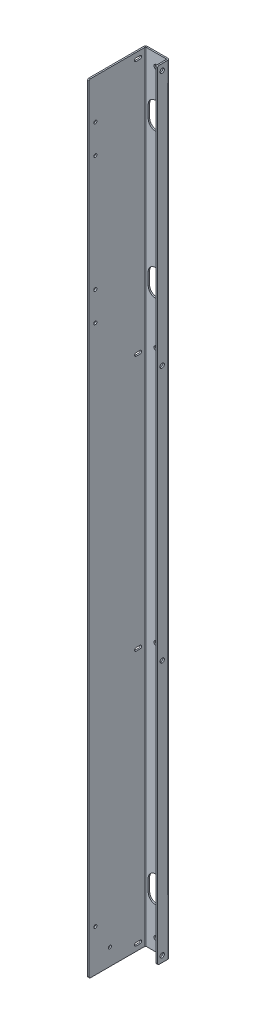
from build123d import *

# Parameters (mm, degrees)
BASE_FLANGE1_DEPTH = 1613
CUT_EXTRUDE1_REACH = 1620.23
FILLET1_R          = 3
CUT_EXTRUDE2_REACH = 1620.23
SKETCH7_R          = 4.5
LPATTERN1_COUNT    = 4
LPATTERN1_PITCH    = 529
CUT_EXTRUDE3_REACH = 1620.23
SKETCH8_R          = 3.25
CUT_EXTRUDE4_REACH = 1619.431
CUT_EXTRUDE5_REACH = 1619.431
SKETCH10_R         = 4.5
LPATTERN2_COUNT    = 3
LPATTERN2_PITCH    = 529
CUT_EXTRUDE6_REACH = 1619.431
SKETCH12_R         = 4.5


# Sheet-metal steps are written as plain solids
with BuildPart() as part:
    # Sketch1 → Base-Flange1 (new body)
    with BuildSketch(Plane(origin=(0, 0, 0), x_dir=(1, 0, 0), z_dir=(0, 1, 0))):
        with BuildLine():
            Line((-25, -120), (-25, -4.5))
            ThreePointArc((-25, -4.5), (-23.681980515, -1.318019485), (-20.5, 0))
            Line((-20.5, 0), (20.5, 0))
            ThreePointArc((20.5, 0), (23.681980515, -1.318019485), (25, -4.5))
            Line((25, -4.5), (25, -25))
            Line((25, -25), (22, -25))
            Line((22, -25), (22, -4.5))
            ThreePointArc((22, -4.5), (21.560660172, -3.439339828), (20.5, -3))
            Line((20.5, -3), (-20.5, -3))
            ThreePointArc((-20.5, -3), (-21.560660172, -3.439339828), (-22, -4.5))
            Line((-22, -4.5), (-22, -120))
            Line((-22, -120), (-25, -120))
        make_face()
    extrude(amount=BASE_FLANGE1_DEPTH)

    # Sketch6 → Cut-Extrude1 (cut, up to next)
    with BuildSketch(Plane.ZY.offset(25), mode=Mode.PRIVATE) as cut_extrude1_sk1:
        with BuildLine():
            Line((14.5, 16.25), (22.5, 16.25))
            ThreePointArc((22.5, 16.25), (25.75, 13), (22.5, 9.75))
            Line((22.5, 9.75), (14.5, 9.75))
            ThreePointArc((14.5, 9.75), (11.25, 13), (14.5, 16.25))
        make_face()
    cut_extrude1_tool1 = extrude(cut_extrude1_sk1.sketch, amount=-CUT_EXTRUDE1_REACH, mode=Mode.PRIVATE) & part.part
    cut_extrude1 = cut_extrude1_tool1.solids().sort_by_distance((-25, 13, 18.5))[0]
    add(cut_extrude1, mode=Mode.SUBTRACT)

    # Fillet1
    fillet1_edges = [part.edges().sort_by_distance(p)[0] for p in [
        (23.5, 0, 25),
        (-23.5, 0, 120),
        (23.5, 1613, 25),
        (-23.5, 1613, 120),
    ]]
    fillet(fillet1_edges, radius=FILLET1_R)

    # Sketch7 → Cut-Extrude2 (cut, up to next)
    with BuildSketch(Plane(origin=(25, 0, 0), x_dir=(0, 0, -1), z_dir=(1, 0, 0)), mode=Mode.PRIVATE) as cut_extrude2_sk1:
        with Locations((-15.5, 13)):
            Circle(SKETCH7_R)
    cut_extrude2_tool1 = extrude(cut_extrude2_sk1.sketch, amount=-CUT_EXTRUDE2_REACH, mode=Mode.PRIVATE) & part.part
    cut_extrude2 = cut_extrude2_tool1.solids().sort_by_distance((25, 13, 15.5))[0]
    add(cut_extrude2, mode=Mode.SUBTRACT)

    # LPattern1: Cut-Extrude1, Cut-Extrude2 ×4
    with Locations(*[(0, i * LPATTERN1_PITCH, 0) for i in range(1, LPATTERN1_COUNT)]):
        add(cut_extrude1, mode=Mode.SUBTRACT)
        add(cut_extrude2, mode=Mode.SUBTRACT)

    # Sketch8 → Cut-Extrude3 (cut, up to next)
    with BuildSketch(Plane.ZY.offset(25), mode=Mode.PRIVATE) as cut_extrude3_sk1:
        with Locations((107, 86.961524227)):
            Circle(SKETCH8_R)
    cut_extrude3_tool1 = extrude(cut_extrude3_sk1.sketch, amount=-CUT_EXTRUDE3_REACH, mode=Mode.PRIVATE) & part.part
    # Sketch8 → Cut-Extrude3 (cut, up to next)
    with BuildSketch(Plane.ZY.offset(25), mode=Mode.PRIVATE) as cut_extrude3_sk2:
        with Locations((77, 35)):
            Circle(SKETCH8_R)
    cut_extrude3_tool2 = extrude(cut_extrude3_sk2.sketch, amount=-CUT_EXTRUDE3_REACH, mode=Mode.PRIVATE) & part.part
    # Sketch8 → Cut-Extrude3 (cut, up to next)
    with BuildSketch(Plane.ZY.offset(25), mode=Mode.PRIVATE) as cut_extrude3_sk3:
        with Locations((107, 1230)):
            Circle(SKETCH8_R)
    cut_extrude3_tool3 = extrude(cut_extrude3_sk3.sketch, amount=-CUT_EXTRUDE3_REACH, mode=Mode.PRIVATE) & part.part
    # Sketch8 → Cut-Extrude3 (cut, up to next)
    with BuildSketch(Plane.ZY.offset(25), mode=Mode.PRIVATE) as cut_extrude3_sk4:
        with Locations((107, 1170)):
            Circle(SKETCH8_R)
    cut_extrude3_tool4 = extrude(cut_extrude3_sk4.sketch, amount=-CUT_EXTRUDE3_REACH, mode=Mode.PRIVATE) & part.part
    # Sketch8 → Cut-Extrude3 (cut, up to next)
    with BuildSketch(Plane.ZY.offset(25), mode=Mode.PRIVATE) as cut_extrude3_sk5:
        with Locations((107, 1530)):
            Circle(SKETCH8_R)
    cut_extrude3_tool5 = extrude(cut_extrude3_sk5.sketch, amount=-CUT_EXTRUDE3_REACH, mode=Mode.PRIVATE) & part.part
    # Sketch8 → Cut-Extrude3 (cut, up to next)
    with BuildSketch(Plane.ZY.offset(25), mode=Mode.PRIVATE) as cut_extrude3_sk6:
        with Locations((107, 1470)):
            Circle(SKETCH8_R)
    cut_extrude3_tool6 = extrude(cut_extrude3_sk6.sketch, amount=-CUT_EXTRUDE3_REACH, mode=Mode.PRIVATE) & part.part
    add(cut_extrude3_tool1.solids().sort_by_distance((-25, 86.961524, 107))[0], mode=Mode.SUBTRACT)
    add(cut_extrude3_tool2.solids().sort_by_distance((-25, 35, 77))[0], mode=Mode.SUBTRACT)
    add(cut_extrude3_tool3.solids().sort_by_distance((-25, 1230, 107))[0], mode=Mode.SUBTRACT)
    add(cut_extrude3_tool4.solids().sort_by_distance((-25, 1170, 107))[0], mode=Mode.SUBTRACT)
    add(cut_extrude3_tool5.solids().sort_by_distance((-25, 1530, 107))[0], mode=Mode.SUBTRACT)
    add(cut_extrude3_tool6.solids().sort_by_distance((-25, 1470, 107))[0], mode=Mode.SUBTRACT)

    # Sketch9 → Cut-Extrude4 (cut, up to next)
    with BuildSketch(Plane.XY.offset(3), mode=Mode.PRIVATE) as cut_extrude4_sk1:
        with BuildLine():
            Line((-16.5, 99.5), (-16.5, 124.5))
            ThreePointArc((-16.5, 124.5), (-1.5, 139.5), (13.5, 124.5))
            Line((13.5, 124.5), (13.5, 99.5))
            ThreePointArc((13.5, 99.5), (-1.5, 84.5), (-16.5, 99.5))
        make_face()
    cut_extrude4_tool1 = extrude(cut_extrude4_sk1.sketch, amount=-CUT_EXTRUDE4_REACH, mode=Mode.PRIVATE) & part.part
    # Sketch9 → Cut-Extrude4 (cut, up to next)
    with BuildSketch(Plane.XY.offset(3), mode=Mode.PRIVATE) as cut_extrude4_sk2:
        with BuildLine():
            Line((-16.5, 1187.5), (-16.5, 1212.5))
            ThreePointArc((-16.5, 1212.5), (-1.5, 1227.5), (13.5, 1212.5))
            Line((13.5, 1212.5), (13.5, 1187.5))
            ThreePointArc((13.5, 1187.5), (-1.5, 1172.5), (-16.5, 1187.5))
        make_face()
    cut_extrude4_tool2 = extrude(cut_extrude4_sk2.sketch, amount=-CUT_EXTRUDE4_REACH, mode=Mode.PRIVATE) & part.part
    # Sketch9 → Cut-Extrude4 (cut, up to next)
    with BuildSketch(Plane.XY.offset(3), mode=Mode.PRIVATE) as cut_extrude4_sk3:
        with BuildLine():
            Line((-16.5, 1487.5), (-16.5, 1512.5))
            ThreePointArc((-16.5, 1512.5), (-1.5, 1527.5), (13.5, 1512.5))
            Line((13.5, 1512.5), (13.5, 1487.5))
            ThreePointArc((13.5, 1487.5), (-1.5, 1472.5), (-16.5, 1487.5))
        make_face()
    cut_extrude4_tool3 = extrude(cut_extrude4_sk3.sketch, amount=-CUT_EXTRUDE4_REACH, mode=Mode.PRIVATE) & part.part
    add(cut_extrude4_tool1.solids().sort_by_distance((-1.5, 112, 3))[0], mode=Mode.SUBTRACT)
    add(cut_extrude4_tool2.solids().sort_by_distance((-1.5, 1200, 3))[0], mode=Mode.SUBTRACT)
    add(cut_extrude4_tool3.solids().sort_by_distance((-1.5, 1500, 3))[0], mode=Mode.SUBTRACT)

    # Sketch10 → Cut-Extrude5 (cut, up to next)
    with BuildSketch(Plane.XY.offset(3), mode=Mode.PRIVATE) as cut_extrude5_sk1:
        with Locations((0, 25)):
            Circle(SKETCH10_R)
    cut_extrude5_tool1 = extrude(cut_extrude5_sk1.sketch, amount=-CUT_EXTRUDE5_REACH, mode=Mode.PRIVATE) & part.part
    cut_extrude5 = cut_extrude5_tool1.solids().sort_by_distance((0, 25, 3))[0]
    add(cut_extrude5, mode=Mode.SUBTRACT)

    # LPattern2: Cut-Extrude5 ×3
    with Locations(*[(0, i * LPATTERN2_PITCH, 0) for i in range(1, LPATTERN2_COUNT)]):
        add(cut_extrude5, mode=Mode.SUBTRACT)

    # Sketch12 → Cut-Extrude6 (cut, up to next)
    with BuildSketch(Plane.XY.offset(3), mode=Mode.PRIVATE) as cut_extrude6_sk1:
        with Locations((0, 1588)):
            Circle(SKETCH12_R)
    cut_extrude6_tool1 = extrude(cut_extrude6_sk1.sketch, amount=-CUT_EXTRUDE6_REACH, mode=Mode.PRIVATE) & part.part
    add(cut_extrude6_tool1.solids().sort_by_distance((0, 1588, 3))[0], mode=Mode.SUBTRACT)


solid = part.part
